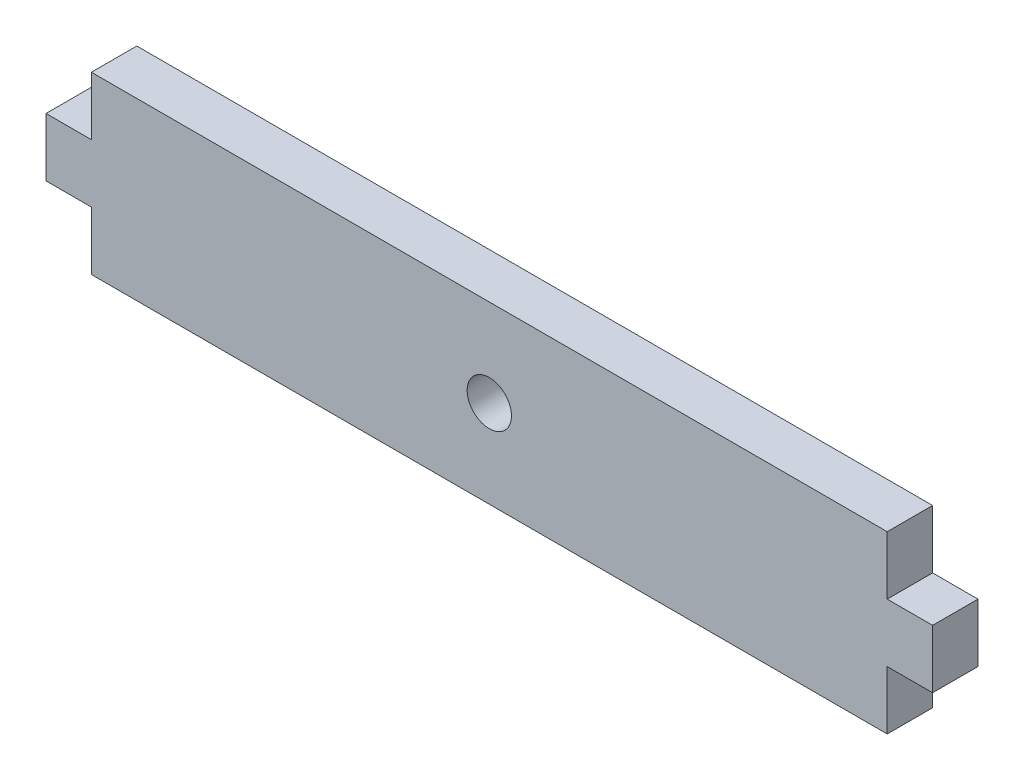
from build123d import *

# Parameters (mm, degrees)
SKETCH1_R           = 2.5
BOSS_EXTRUDE1_DEPTH = 5.12


with BuildPart() as part:
    # Sketch1 → Boss-Extrude1 (new body)
    with BuildSketch(Plane.XY):
        Polygon((5.12, -1.162405209), (94.88, -1.162405209), (94.88, 5.424557644), (100, 5.424557644), (100, 12.011520496), (94.88, 12.011520496), (94.88, 18.598483349), (5.12, 18.598483349), (5.12, 12.011520496), (0, 12.011520496), (0, 5.424557644), (5.12, 5.424557644), align=None)
        with Locations((50, 8.71803907)):
            Circle(SKETCH1_R, mode=Mode.SUBTRACT)
    extrude(amount=BOSS_EXTRUDE1_DEPTH)


solid = part.part
